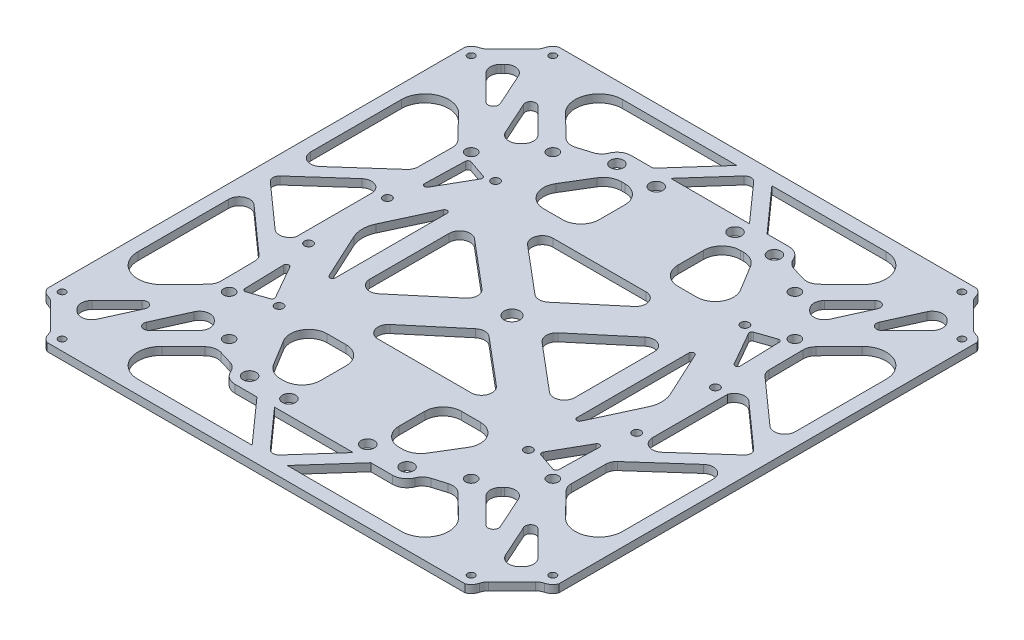
from build123d import *

# Parameters (mm, degrees)
SKETCH2_W               = 195
SKETCH2_H               = 195
BOSS_EXTRUDE1_DEPTH     = 3
CUT_EXTRUDE1_DEPTH      = 138.918454168
CUT_EXTRUDE1_DEPTH_BACK = 138.918454168
SKETCH3_R               = 1.6
CUT_EXTRUDE2_DEPTH      = 138.918454168
CUT_EXTRUDE2_DEPTH_BACK = 138.918454168
SKETCH4_R               = 2.11
SKETCH4_R_2             = 1.35
CUT_EXTRUDE3_DEPTH      = 138.918454168
CUT_EXTRUDE3_DEPTH_BACK = 138.918454168
SKETCH5_R               = 2.5
CUT_EXTRUDE4_DEPTH      = 138.918454168
CUT_EXTRUDE4_DEPTH_BACK = 138.918454168
SKETCH6_R               = 1.6
CUT_EXTRUDE5_DEPTH      = 138.918454168
CUT_EXTRUDE5_DEPTH_BACK = 138.918454168
CUT_EXTRUDE7_DEPTH      = 138.918454168
CUT_EXTRUDE7_DEPTH_BACK = 138.918454168
SKETCH8_R               = 3
SKETCH9_W               = 5.16198808
SKETCH9_H               = 152.468237428
BOSS_EXTRUDE2_DEPTH     = 3
FILLET1_R               = 9
BOSS_EXTRUDE3_DEPTH     = 3
FILLET2_DEPTH           = 3
FILLET3_R               = 2.5


with BuildPart() as part:
    # Sketch2 → Boss-Extrude1 (new body)
    with BuildSketch(Plane(origin=(0, 0, 0), x_dir=(1, 0, 0), z_dir=(0, 1, 0))):
        Rectangle(SKETCH2_W, SKETCH2_H)
    extrude(amount=BOSS_EXTRUDE1_DEPTH)

    # Sketch3 → Cut-Extrude1 (cut, two sides: drawn at the far end of the back side and taken through both)
    with BuildSketch(Plane(origin=(0, 3, 0), x_dir=(1, 0, 0), z_dir=(0, 1, 0)).offset(-CUT_EXTRUDE1_DEPTH_BACK)):
        with Locations(Location((47.5, 41.25, 0), (0, 0, 270))):
            Circle(SKETCH3_R)
        with Locations(Location((47.5, -41.25, 0), (0, 0, 90))):
            Circle(SKETCH3_R)
        with Locations(Location((-47.5, -41.25, 0), (0, 0, 270))):
            Circle(SKETCH3_R)
        with Locations(Location((-47.5, 41.25, 0), (0, 0, 90))):
            Circle(SKETCH3_R)
    extrude(amount=CUT_EXTRUDE1_DEPTH + CUT_EXTRUDE1_DEPTH_BACK, mode=Mode.SUBTRACT)

    # Sketch4 → Cut-Extrude2 (cut, two sides: drawn at the far end of the back side and taken through both)
    with BuildSketch(Plane(origin=(0, 3, 0), x_dir=(1, 0, 0), z_dir=(0, 1, 0)).offset(-CUT_EXTRUDE2_DEPTH_BACK)):
        with Locations(Location((46.123845661, 61.680194847, 0), (0, 0, 90))):
            Circle(SKETCH4_R)
        with Locations(Location((-61.680194847, 46.123845661, 0), (0, 0, 90))):
            Circle(SKETCH4_R)
        with Locations(Location((-77.943650814, 93.5, 0), (0, 0, 270))):
            Circle(SKETCH4_R_2)
        with Locations(Location((-93.5, 77.943650814, 0), (0, 0, 90))):
            Circle(SKETCH4_R_2)
        with Locations(Location((-46.123845661, 61.680194847, 0), (0, 0, 270))):
            Circle(SKETCH4_R)
        with Locations(Location((93.5, 77.943650814, 0), (0, 0, 270))):
            Circle(SKETCH4_R_2)
        with Locations(Location((77.943650814, 93.5, 0), (0, 0, 90))):
            Circle(SKETCH4_R_2)
        with Locations(Location((61.680194847, 46.123845661, 0), (0, 0, 270))):
            Circle(SKETCH4_R)
        with Locations(Location((61.680194847, -46.123845661, 0), (0, 0, 90))):
            Circle(SKETCH4_R)
        with Locations(Location((77.943650814, -93.5, 0), (0, 0, 270))):
            Circle(SKETCH4_R_2)
        with Locations(Location((93.5, -77.943650814, 0), (0, 0, 90))):
            Circle(SKETCH4_R_2)
        with Locations(Location((-46.123845661, -61.680194847, 0), (0, 0, 90))):
            Circle(SKETCH4_R)
        with Locations(Location((-93.5, -77.943650814, 0), (0, 0, 270))):
            Circle(SKETCH4_R_2)
        with Locations(Location((-77.943650814, -93.5, 0), (0, 0, 90))):
            Circle(SKETCH4_R_2)
        with Locations(Location((-61.680194847, -46.123845661, 0), (0, 0, 270))):
            Circle(SKETCH4_R)
        with Locations(Location((46.123845661, -61.680194847, 0), (0, 0, 270))):
            Circle(SKETCH4_R)
    extrude(amount=CUT_EXTRUDE2_DEPTH + CUT_EXTRUDE2_DEPTH_BACK, mode=Mode.SUBTRACT)

    # Sketch5 → Cut-Extrude3 (cut, two sides: drawn at the far end of the back side and taken through both)
    with BuildSketch(Plane(origin=(0, 3, 0), x_dir=(1, 0, 0), z_dir=(0, 1, 0)).offset(-CUT_EXTRUDE3_DEPTH_BACK)):
        with Locations(Location((30, 70, 0), (0, 0, 270))):
            Circle(SKETCH5_R)
        with Locations(Location((15, 70, 0), (0, 0, 270))):
            Circle(SKETCH5_R)
        with Locations(Location((-15, 70, 0), (0, 0, 90))):
            Circle(SKETCH5_R)
        with Locations(Location((-30, 70, 0), (0, 0, 90))):
            Circle(SKETCH5_R)
        with Locations(Location((-30, -70, 0), (0, 0, 270))):
            Circle(SKETCH5_R)
        with Locations(Location((-15, -70, 0), (0, 0, 270))):
            Circle(SKETCH5_R)
        with Locations(Location((15, -70, 0), (0, 0, 90))):
            Circle(SKETCH5_R)
        with Locations(Location((30, -70, 0), (0, 0, 90))):
            Circle(SKETCH5_R)
    extrude(amount=CUT_EXTRUDE3_DEPTH + CUT_EXTRUDE3_DEPTH_BACK, mode=Mode.SUBTRACT)

    # Sketch6 → Cut-Extrude4 (cut, two sides: drawn at the far end of the back side and taken through both)
    with BuildSketch(Plane(origin=(0, 3, 0), x_dir=(1, 0, 0), z_dir=(0, 1, 0)).offset(-CUT_EXTRUDE4_DEPTH_BACK)):
        with Locations(Location((-62.5, 15, 0), (0, 0, 270))):
            Circle(SKETCH6_R)
        with Locations(Location((-62.5, -15, 0), (0, 0, 90))):
            Circle(SKETCH6_R)
        with Locations(Location((62.5, -15, 0), (0, 0, 270))):
            Circle(SKETCH6_R)
        with Locations(Location((62.5, 15, 0), (0, 0, 90))):
            Circle(SKETCH6_R)
    extrude(amount=CUT_EXTRUDE4_DEPTH + CUT_EXTRUDE4_DEPTH_BACK, mode=Mode.SUBTRACT)

    # Sketch7 → Cut-Extrude5 (cut, two sides: drawn at the far end of the back side and taken through both)
    with BuildSketch(Plane(origin=(0, 3, 0), x_dir=(1, 0, 0), z_dir=(0, 1, 0)).offset(-CUT_EXTRUDE5_DEPTH_BACK)):
        with BuildLine():
            Line((-67.1, -15), (-67.099088544, 15.091567253))
            Line((-67.099088544, 15.091567253), (-66.810690491, 44.064798997))
            ThreePointArc((-66.810690491, 44.064798997), (-67.168435752, 45.972460378), (-68.225667159, 47.60016286))
            Line((-68.225667159, 47.60016286), (-92.33801192, 72.39859956))
            ThreePointArc((-92.33801192, 72.39859956), (-93.391805503, 73.22509409), (-94.627179243, 73.742226418))
            ThreePointArc((-94.627179243, 73.742226418), (-96.350328674, 74.657600533), (-97.5, 76.234118714))
            Line((-97.5, 76.234118714), (-97.5, -76.234118714))
            ThreePointArc((-97.5, -76.234118714), (-96.350328674, -74.657600533), (-94.627179243, -73.742226418))
            ThreePointArc((-94.627179243, -73.742226418), (-93.391805503, -73.22509409), (-92.33801192, -72.39859956))
            Line((-92.33801192, -72.39859956), (-68.225667159, -47.60016286))
            ThreePointArc((-68.225667159, -47.60016286), (-67.168435752, -45.972460378), (-66.810690491, -44.064798997))
            Line((-66.810690491, -44.064798997), (-67.099088544, -15.091567253))
            ThreePointArc((-67.099088544, -15.091567253), (-67.09977213, -15.045785894), (-67.1, -15))
        make_face()
        with BuildLine():
            ThreePointArc((-97.5, 79.653182914), (-96.342305944, 81.236642906), (-94.606672429, 82.150523302))
            ThreePointArc((-94.606672429, 82.150523302), (-93.388598506, 82.650187636), (-92.343175799, 83.450475015))
            Line((-92.343175799, 83.450475015), (-83.450475015, 92.343175799))
            ThreePointArc((-83.450475015, 92.343175799), (-82.650187636, 93.388598506), (-82.150523302, 94.606672429))
            ThreePointArc((-82.150523302, 94.606672429), (-81.236642906, 96.342305944), (-79.653182914, 97.5))
            Line((-79.653182914, 97.5), (-97.5, 97.5))
            Line((-97.5, 97.5), (-97.5, 79.653182914))
        make_face()
        with BuildLine():
            ThreePointArc((-94.606672429, -82.150523302), (-96.342305944, -81.236642906), (-97.5, -79.653182914))
            Line((-97.5, -79.653182914), (-97.5, -97.5))
            Line((-97.5, -97.5), (-79.653182914, -97.5))
            ThreePointArc((-79.653182914, -97.5), (-81.236642906, -96.342305944), (-82.150523302, -94.606672429))
            ThreePointArc((-82.150523302, -94.606672429), (-82.650187636, -93.388598506), (-83.450475015, -92.343175799))
            Line((-83.450475015, -92.343175799), (-92.343175799, -83.450475015))
            ThreePointArc((-92.343175799, -83.450475015), (-93.388598506, -82.650187636), (-94.606672429, -82.150523302))
        make_face()
        with BuildLine():
            Line((76.234118714, 97.5), (-76.234118714, 97.5))
            ThreePointArc((-76.234118714, 97.5), (-74.657600533, 96.350328674), (-73.742226418, 94.627179243))
            ThreePointArc((-73.742226418, 94.627179243), (-73.22509409, 93.391805503), (-72.39859956, 92.33801192))
            Line((-72.39859956, 92.33801192), (-48.235759925, 68.843679325))
            ThreePointArc((-48.235759925, 68.843679325), (-45.933721874, 67.570555303), (-43.304064218, 67.642141429))
            Line((-43.304064218, 67.642141429), (-38.28462916, 69.158674052))
            ThreePointArc((-38.28462916, 69.158674052), (-36.361057884, 70.251030176), (-35.097048147, 72.066422073))
            ThreePointArc((-35.097048147, 72.066422073), (-33.072838964, 74.561541483), (-30, 75.5))
            Line((-30, 75.5), (30, 75.5))
            ThreePointArc((30, 75.5), (33.072838964, 74.561541483), (35.097048147, 72.066422073))
            ThreePointArc((35.097048147, 72.066422073), (36.361057884, 70.251030176), (38.28462916, 69.158674052))
            Line((38.28462916, 69.158674052), (43.304064218, 67.642141429))
            ThreePointArc((43.304064218, 67.642141429), (45.933721874, 67.570555303), (48.235759925, 68.843679325))
            Line((48.235759925, 68.843679325), (72.39859956, 92.33801192))
            ThreePointArc((72.39859956, 92.33801192), (73.22509409, 93.391805503), (73.742226418, 94.627179243))
            ThreePointArc((73.742226418, 94.627179243), (74.657600533, 96.350328674), (76.234118714, 97.5))
        make_face()
        with BuildLine():
            ThreePointArc((-73.742226418, -94.627179243), (-74.657600533, -96.350328674), (-76.234118714, -97.5))
            Line((-76.234118714, -97.5), (76.234118714, -97.5))
            ThreePointArc((76.234118714, -97.5), (74.657600533, -96.350328674), (73.742226418, -94.627179243))
            ThreePointArc((73.742226418, -94.627179243), (73.22509409, -93.391805503), (72.39859956, -92.33801192))
            Line((72.39859956, -92.33801192), (48.235759925, -68.843679325))
            ThreePointArc((48.235759925, -68.843679325), (45.933721874, -67.570555303), (43.304064218, -67.642141429))
            Line((43.304064218, -67.642141429), (38.28462916, -69.158674052))
            ThreePointArc((38.28462916, -69.158674052), (36.361057884, -70.251030176), (35.097048147, -72.066422073))
            ThreePointArc((35.097048147, -72.066422073), (33.072838964, -74.561541483), (30, -75.5))
            Line((30, -75.5), (-30, -75.5))
            ThreePointArc((-30, -75.5), (-33.072838964, -74.561541483), (-35.097048147, -72.066422073))
            ThreePointArc((-35.097048147, -72.066422073), (-36.361057884, -70.251030176), (-38.28462916, -69.158674052))
            Line((-38.28462916, -69.158674052), (-43.304064218, -67.642141429))
            ThreePointArc((-43.304064218, -67.642141429), (-45.933721874, -67.570555303), (-48.235759925, -68.843679325))
            Line((-48.235759925, -68.843679325), (-72.39859956, -92.33801192))
            ThreePointArc((-72.39859956, -92.33801192), (-73.22509409, -93.391805503), (-73.742226418, -94.627179243))
        make_face()
        with BuildLine():
            Line((97.5, 97.5), (79.653182914, 97.5))
            ThreePointArc((79.653182914, 97.5), (81.236642906, 96.342305944), (82.150523302, 94.606672429))
            ThreePointArc((82.150523302, 94.606672429), (82.650187636, 93.388598506), (83.450475015, 92.343175799))
            Line((83.450475015, 92.343175799), (92.343175799, 83.450475015))
            ThreePointArc((92.343175799, 83.450475015), (93.388598506, 82.650187636), (94.606672429, 82.150523302))
            ThreePointArc((94.606672429, 82.150523302), (96.342305944, 81.236642906), (97.5, 79.653182914))
            Line((97.5, 79.653182914), (97.5, 97.5))
        make_face()
        with BuildLine():
            ThreePointArc((82.150523302, -94.606672429), (81.236642906, -96.342305944), (79.653182914, -97.5))
            Line((79.653182914, -97.5), (97.5, -97.5))
            Line((97.5, -97.5), (97.5, -79.653182914))
            ThreePointArc((97.5, -79.653182914), (96.342305944, -81.236642906), (94.606672429, -82.150523302))
            ThreePointArc((94.606672429, -82.150523302), (93.388598506, -82.650187636), (92.343175799, -83.450475015))
            Line((92.343175799, -83.450475015), (83.450475015, -92.343175799))
            ThreePointArc((83.450475015, -92.343175799), (82.650187636, -93.388598506), (82.150523302, -94.606672429))
        make_face()
        with BuildLine():
            ThreePointArc((94.627179243, -73.742226418), (96.350328674, -74.657600533), (97.5, -76.234118714))
            Line((97.5, -76.234118714), (97.5, 76.234118714))
            ThreePointArc((97.5, 76.234118714), (96.350328674, 74.657600533), (94.627179243, 73.742226418))
            ThreePointArc((94.627179243, 73.742226418), (93.391805503, 73.22509409), (92.33801192, 72.39859956))
            Line((92.33801192, 72.39859956), (68.225667159, 47.60016286))
            ThreePointArc((68.225667159, 47.60016286), (67.168435752, 45.972460378), (66.810690491, 44.064798997))
            Line((66.810690491, 44.064798997), (67.099088544, 15.091567253))
            ThreePointArc((67.099088544, 15.091567253), (67.09977213, 15.045785894), (67.1, 15))
            Line((67.1, 15), (67.099088544, -15.091567253))
            Line((67.099088544, -15.091567253), (66.810690491, -44.064798997))
            ThreePointArc((66.810690491, -44.064798997), (67.168435752, -45.972460378), (68.225667159, -47.60016286))
            Line((68.225667159, -47.60016286), (92.33801192, -72.39859956))
            ThreePointArc((92.33801192, -72.39859956), (93.391805503, -73.22509409), (94.627179243, -73.742226418))
        make_face()
    extrude(amount=CUT_EXTRUDE5_DEPTH + CUT_EXTRUDE5_DEPTH_BACK, mode=Mode.SUBTRACT)

    # Sketch8 → Cut-Extrude7 (cut, two sides: drawn at the far end of the back side and taken through both)
    with BuildSketch(Plane(origin=(0, 3, 0), x_dir=(1, 0, 0), z_dir=(0, 1, 0)).offset(-CUT_EXTRUDE7_DEPTH_BACK)):
        with Locations(Location((0, 0, 0), (0, 0, 270))):
            Circle(SKETCH8_R)
        with BuildLine():
            Line((-46.075946512, -21.34896745), (-46.075946512, 21.363521254))
            ThreePointArc((-46.075946512, 21.363521254), (-46.860319172, 22.339996984), (-47.982956213, 21.784630983))
            Line((-47.982956213, 21.784630983), (-56.124255266, 4.249445458))
            ThreePointArc((-56.124255266, 4.249445458), (-57.054155987, 0.045094312), (-56.129928738, -4.160507655))
            Line((-56.129928738, -4.160507655), (-47.98352356, -21.768853033))
            ThreePointArc((-47.98352356, -21.768853033), (-46.860977965, -22.325588422), (-46.075946512, -21.34896745))
        make_face()
        with BuildLine():
            Line((56.124255266, 4.249445458), (47.982956213, 21.784630983))
            ThreePointArc((47.982956213, 21.784630983), (46.860319172, 22.339996984), (46.075946512, 21.363521254))
            Line((46.075946512, 21.363521254), (46.075946512, -21.34896745))
            ThreePointArc((46.075946512, -21.34896745), (46.860977965, -22.325588422), (47.98352356, -21.768853033))
            Line((47.98352356, -21.768853033), (56.129928738, -4.160507655))
            ThreePointArc((56.129928738, -4.160507655), (57.054155987, 0.045094312), (56.124255266, 4.249445458))
        make_face()
        with BuildLine():
            Line((-58.318731361, 26.348348992), (-51.034926184, 39.095008052))
            ThreePointArc((-51.034926184, 39.095008052), (-50.967376772, 39.943698114), (-51.578125125, 40.536845815))
            Line((-51.578125125, 40.536845815), (-58.463843567, 42.903521965))
            ThreePointArc((-58.463843567, 42.903521965), (-59.359048857, 42.779356057), (-59.788541049, 41.984154106))
            Line((-59.788541049, 41.984154106), (-60.186627783, 26.870818896))
            ThreePointArc((-60.186627783, 26.870818896), (-59.456345727, 25.881451512), (-58.318731361, 26.348348992))
        make_face()
        with BuildLine():
            Line((-59.788541049, -41.984154106), (-60.186627783, -26.870818896))
            ThreePointArc((-60.186627783, -26.870818896), (-59.456345727, -25.881451512), (-58.318731361, -26.348348992))
            Line((-58.318731361, -26.348348992), (-51.034926184, -39.095008052))
            ThreePointArc((-51.034926184, -39.095008052), (-50.967376772, -39.943698114), (-51.578125125, -40.536845815))
            Line((-51.578125125, -40.536845815), (-58.463843567, -42.903521965))
            ThreePointArc((-58.463843567, -42.903521965), (-59.359048857, -42.779356057), (-59.788541049, -41.984154106))
        make_face()
        with BuildLine():
            Line((59.788541049, 41.984154106), (60.186627783, 26.870818896))
            ThreePointArc((60.186627783, 26.870818896), (59.456345727, 25.881451512), (58.318731361, 26.348348992))
            Line((58.318731361, 26.348348992), (51.034926184, 39.095008052))
            ThreePointArc((51.034926184, 39.095008052), (50.967376772, 39.943698114), (51.578125125, 40.536845815))
            Line((51.578125125, 40.536845815), (58.463843567, 42.903521965))
            ThreePointArc((58.463843567, 42.903521965), (59.359048857, 42.779356057), (59.788541049, 41.984154106))
        make_face()
        with BuildLine():
            Line((58.318731361, -26.348348992), (51.034926184, -39.095008052))
            ThreePointArc((51.034926184, -39.095008052), (50.967376772, -39.943698114), (51.578125125, -40.536845815))
            Line((51.578125125, -40.536845815), (58.463843567, -42.903521965))
            ThreePointArc((58.463843567, -42.903521965), (59.359048857, -42.779356057), (59.788541049, -41.984154106))
            Line((59.788541049, -41.984154106), (60.186627783, -26.870818896))
            ThreePointArc((60.186627783, -26.870818896), (59.456345727, -25.881451512), (58.318731361, -26.348348992))
        make_face()
        with BuildLine():
            Line((-29.190874416, -41.25), (-22, -41.25))
            ThreePointArc((-22, -41.25), (-17.050252532, -43.300252532), (-15, -48.25))
            Line((-15, -48.25), (-15, -58))
            ThreePointArc((-15, -58), (-17.050252532, -62.949747468), (-22, -65))
            Line((-22, -65), (-23.256091807, -65))
            ThreePointArc((-23.256091807, -65), (-26.685566957, -64.102352022), (-29.235481697, -61.639628628))
            Line((-29.235481697, -61.639628628), (-35.170264305, -51.889628628))
            ThreePointArc((-35.170264305, -51.889628628), (-35.293226438, -44.82052485), (-29.190874416, -41.25))
        make_face()
        with BuildLine():
            Line((29.190874416, 41.25), (22, 41.25))
            ThreePointArc((22, 41.25), (17.050252532, 43.300252532), (15, 48.25))
            Line((15, 48.25), (15, 58))
            ThreePointArc((15, 58), (17.050252532, 62.949747468), (22, 65))
            Line((22, 65), (23.256091807, 65))
            ThreePointArc((23.256091807, 65), (26.685566957, 64.102352022), (29.235481697, 61.639628628))
            Line((29.235481697, 61.639628628), (35.170264305, 51.889628628))
            ThreePointArc((35.170264305, 51.889628628), (35.293226438, 44.82052485), (29.190874416, 41.25))
        make_face()
        with BuildLine():
            Line((29.235481697, -61.639628628), (35.170264305, -51.889628628))
            ThreePointArc((35.170264305, -51.889628628), (35.293226438, -44.82052485), (29.190874416, -41.25))
            Line((29.190874416, -41.25), (22, -41.25))
            ThreePointArc((22, -41.25), (17.050252532, -43.300252532), (15, -48.25))
            Line((15, -48.25), (15, -58))
            ThreePointArc((15, -58), (17.050252532, -62.949747468), (22, -65))
            Line((22, -65), (23.256091807, -65))
            ThreePointArc((23.256091807, -65), (26.685566957, -64.102352022), (29.235481697, -61.639628628))
        make_face()
        with BuildLine():
            Line((-29.235481697, 61.639628628), (-35.170264305, 51.889628628))
            ThreePointArc((-35.170264305, 51.889628628), (-35.293226438, 44.82052485), (-29.190874416, 41.25))
            Line((-29.190874416, 41.25), (-22, 41.25))
            ThreePointArc((-22, 41.25), (-17.050252532, 43.300252532), (-15, 48.25))
            Line((-15, 48.25), (-15, 58))
            ThreePointArc((-15, 58), (-17.050252532, 62.949747468), (-22, 65))
            Line((-22, 65), (-23.256091807, 65))
            ThreePointArc((-23.256091807, 65), (-26.685566957, 64.102352022), (-29.235481697, 61.639628628))
        make_face()
        with BuildLine():
            Line((-55.317751874, 58.143142882), (-54.609127035, 58.851767722))
            ThreePointArc((-54.609127035, 58.851767722), (-53.437554159, 61.680194847), (-54.609127035, 64.508621971))
            Line((-54.609127035, 64.508621971), (-64.215657306, 74.115152242))
            ThreePointArc((-64.215657306, 74.115152242), (-66.766627573, 74.346473303), (-67.453044382, 71.878723174))
            Line((-67.453044382, 71.878723174), (-61.792526027, 59.327138995))
            ThreePointArc((-61.792526027, 59.327138995), (-58.865699631, 57.036815878), (-55.317751874, 58.143142882))
        make_face()
        with BuildLine():
            Line((-84.306093786, 81.480702778), (-85.014718626, 80.772077939))
            ThreePointArc((-85.014718626, 80.772077939), (-86.186291501, 77.943650814), (-85.014718626, 75.115223689))
            Line((-85.014718626, 75.115223689), (-75.408188355, 65.508693418))
            ThreePointArc((-75.408188355, 65.508693418), (-72.857218088, 65.277372358), (-72.170801279, 67.745122487))
            Line((-72.170801279, 67.745122487), (-77.831319634, 80.296706666))
            ThreePointArc((-77.831319634, 80.296706666), (-80.758146029, 82.587029783), (-84.306093786, 81.480702778))
        make_face()
        with BuildLine():
            Line((55.317751874, -58.143142882), (54.609127035, -58.851767722))
            ThreePointArc((54.609127035, -58.851767722), (53.437554159, -61.680194847), (54.609127035, -64.508621971))
            Line((54.609127035, -64.508621971), (64.215657306, -74.115152242))
            ThreePointArc((64.215657306, -74.115152242), (66.766627573, -74.346473303), (67.453044382, -71.878723174))
            Line((67.453044382, -71.878723174), (61.792526027, -59.327138995))
            ThreePointArc((61.792526027, -59.327138995), (58.865699631, -57.036815878), (55.317751874, -58.143142882))
        make_face()
        with BuildLine():
            Line((-32.5, -18.207707646), (-14.5051535, -3.060146984))
            ThreePointArc((-14.5051535, -3.060146984), (-13.081100012, 0), (-14.5051535, 3.060146984))
            Line((-14.5051535, 3.060146984), (-32.5, 18.207707646))
            ThreePointArc((-32.5, 18.207707646), (-36.763580055, 18.774114539), (-39.075946512, 15.147560662))
            Line((-39.075946512, 15.147560662), (-39.075946512, -15.147560662))
            ThreePointArc((-39.075946512, -15.147560662), (-36.763580055, -18.774114539), (-32.5, -18.207707646))
        make_face()
        with BuildLine():
            Line((67.453044382, 71.878723174), (61.792526027, 59.327138995))
            ThreePointArc((61.792526027, 59.327138995), (58.865699631, 57.036815878), (55.317751874, 58.143142882))
            Line((55.317751874, 58.143142882), (54.609127035, 58.851767722))
            ThreePointArc((54.609127035, 58.851767722), (53.437554159, 61.680194847), (54.609127035, 64.508621971))
            Line((54.609127035, 64.508621971), (64.215657306, 74.115152242))
            ThreePointArc((64.215657306, 74.115152242), (66.766627573, 74.346473303), (67.453044382, 71.878723174))
        make_face()
        with BuildLine():
            Line((77.831319634, 80.296706666), (72.170801279, 67.745122487))
            ThreePointArc((72.170801279, 67.745122487), (72.857218088, 65.277372358), (75.408188355, 65.508693418))
            Line((75.408188355, 65.508693418), (85.014718626, 75.115223689))
            ThreePointArc((85.014718626, 75.115223689), (86.186291501, 77.943650814), (85.014718626, 80.772077939))
            Line((85.014718626, 80.772077939), (84.306093786, 81.480702778))
            ThreePointArc((84.306093786, 81.480702778), (80.758146029, 82.587029783), (77.831319634, 80.296706666))
        make_face()
        with BuildLine():
            Line((84.306093786, -81.480702778), (85.014718626, -80.772077939))
            ThreePointArc((85.014718626, -80.772077939), (86.186291501, -77.943650814), (85.014718626, -75.115223689))
            Line((85.014718626, -75.115223689), (75.408188355, -65.508693418))
            ThreePointArc((75.408188355, -65.508693418), (72.857218088, -65.277372358), (72.170801279, -67.745122487))
            Line((72.170801279, -67.745122487), (77.831319634, -80.296706666))
            ThreePointArc((77.831319634, -80.296706666), (80.758146029, -82.587029783), (84.306093786, -81.480702778))
        make_face()
        with BuildLine():
            Line((-67.453044382, -71.878723174), (-61.792526027, -59.327138995))
            ThreePointArc((-61.792526027, -59.327138995), (-58.865699631, -57.036815878), (-55.317751874, -58.143142882))
            Line((-55.317751874, -58.143142882), (-54.609127035, -58.851767722))
            ThreePointArc((-54.609127035, -58.851767722), (-53.437554159, -61.680194847), (-54.609127035, -64.508621971))
            Line((-54.609127035, -64.508621971), (-64.215657306, -74.115152242))
            ThreePointArc((-64.215657306, -74.115152242), (-66.766627573, -74.346473303), (-67.453044382, -71.878723174))
        make_face()
        with BuildLine():
            Line((-77.831319634, -80.296706666), (-72.170801279, -67.745122487))
            ThreePointArc((-72.170801279, -67.745122487), (-72.857218088, -65.277372358), (-75.408188355, -65.508693418))
            Line((-75.408188355, -65.508693418), (-85.014718626, -75.115223689))
            ThreePointArc((-85.014718626, -75.115223689), (-86.186291501, -77.943650814), (-85.014718626, -80.772077939))
            Line((-85.014718626, -80.772077939), (-84.306093786, -81.480702778))
            ThreePointArc((-84.306093786, -81.480702778), (-80.758146029, -82.587029783), (-77.831319634, -80.296706666))
        make_face()
        with BuildLine():
            Line((-20.31441961, 26.25), (-2.575946512, 11.318247329))
            ThreePointArc((-2.575946512, 11.318247329), (0, 10.378394314), (2.575946512, 11.318247329))
            Line((2.575946512, 11.318247329), (20.31441961, 26.25))
            ThreePointArc((20.31441961, 26.25), (21.496171059, 30.681170701), (17.738473098, 33.310146984))
            Line((17.738473098, 33.310146984), (-17.738473098, 33.310146984))
            ThreePointArc((-17.738473098, 33.310146984), (-21.496171059, 30.681170701), (-20.31441961, 26.25))
        make_face()
        with BuildLine():
            Line((32.5, -18.207707646), (14.5051535, -3.060146984))
            ThreePointArc((14.5051535, -3.060146984), (13.081100012, 0), (14.5051535, 3.060146984))
            Line((14.5051535, 3.060146984), (32.5, 18.207707646))
            ThreePointArc((32.5, 18.207707646), (36.763580055, 18.774114539), (39.075946512, 15.147560662))
            Line((39.075946512, 15.147560662), (39.075946512, -15.147560662))
            ThreePointArc((39.075946512, -15.147560662), (36.763580055, -18.774114539), (32.5, -18.207707646))
        make_face()
        with BuildLine():
            Line((17.738473098, -33.310146984), (-17.738473098, -33.310146984))
            ThreePointArc((-17.738473098, -33.310146984), (-21.496171059, -30.681170701), (-20.31441961, -26.25))
            Line((-20.31441961, -26.25), (-2.575946512, -11.318247329))
            ThreePointArc((-2.575946512, -11.318247329), (0, -10.378394314), (2.575946512, -11.318247329))
            Line((2.575946512, -11.318247329), (20.31441961, -26.25))
            ThreePointArc((20.31441961, -26.25), (21.496171059, -30.681170701), (17.738473098, -33.310146984))
        make_face()
    extrude(amount=CUT_EXTRUDE7_DEPTH + CUT_EXTRUDE7_DEPTH_BACK, mode=Mode.SUBTRACT)

    # Sketch9 → Boss-Extrude2 (add)
    with BuildSketch(Plane(origin=(0, 0, 0), x_dir=(1, 0, 0), z_dir=(0, 1, 0))):
        Polygon((-76.234118714, 97.5), (76.234118714, 97.5), (75.78009356, 93.391805503), (72.39859956, 92.33801192), (-72.39859956, 92.33801192), (-74.953859457, 93.391805503), align=None)
        with Locations((-94.91900596, 0)):
            Rectangle(SKETCH9_W, SKETCH9_H)
        with Locations((94.91900596, 0)):
            Rectangle(SKETCH9_W, SKETCH9_H)
        Polygon((-74.953859457, -93.391805503), (-72.39859956, -92.33801192), (72.39859956, -92.33801192), (75.78009356, -93.391805503), (76.234118714, -97.5), (-76.234118714, -97.5), align=None)
    extrude(amount=BOSS_EXTRUDE2_DEPTH)

    # Fillet1
    fillet1_edges = [part.edges().sort_by_distance(p)[0] for p in [
        (92.33801192, 1.5, -72.39859956),
        (72.39859956, 1.5, -92.33801192),
        (-72.39859956, 1.5, -92.33801192),
        (-92.33801192, 1.5, -72.39859956),
        (-92.33801192, 1.5, 72.39859956),
        (-72.39859956, 1.5, 92.33801192),
        (72.39859956, 1.5, 92.33801192),
        (92.33801192, 1.5, 72.39859956),
    ]]
    fillet(fillet1_edges, radius=FILLET1_R)

    # Sketch10 → Boss-Extrude3 (add)
    with BuildSketch(Plane(origin=(0, 0, 0), x_dir=(1, 0, 0), z_dir=(0, 1, 0))):
        Polygon((0, 92.33801192), (-6.696265003, 92.33801192), (-21.696265003, 75.5), (-15, 75.5), align=None)
        Polygon((6.696265003, 92.33801192), (0, 92.33801192), (15, 75.5), (21.696265003, 75.5), align=None)
        Polygon((92.33801192, 0), (66.810630595, -22.74085098), (66.810649404, -29.437099228), (92.33801192, -6.696265003), align=None)
        Polygon((66.810502842, 22.740964787), (92.33801192, 0), (92.33801192, 6.696265003), (66.810484033, 29.437246546), align=None)
        Polygon((0, -92.33801192), (6.696265003, -92.33801192), (21.696265003, -75.5), (15, -75.5), align=None)
        Polygon((-6.696265003, -92.33801192), (0, -92.33801192), (-15, -75.5), (-21.696265003, -75.5), align=None)
        Polygon((-92.33801192, 0), (-92.33801192, -6.696265003), (-66.810649404, -29.437099228), (-66.810630595, -22.74085098), align=None)
        Polygon((-92.33801192, 6.696265003), (-92.33801192, 0), (-66.810502842, 22.740964787), (-66.810484033, 29.437246546), align=None)
    extrude(amount=BOSS_EXTRUDE3_DEPTH)

    # Fillet2: read off the stored shape, not the designer's step
    # Fillet2 outline → Fillet2 (add)
    with BuildSketch(Plane(origin=(0, 0, 0), x_dir=(1, 0, 0), z_dir=(0, 1, 0))):
        with BuildLine():
            Line((66.9575969, 29.306192298), (68.279071597, 28.12896778))
            ThreePointArc((68.279071597, 28.12896778), (67.298121129, 29.460927331), (66.939981385, 31.075893581))
            Line((66.939981385, 31.075893581), (66.9575969, 29.306192298))
        make_face()
        with BuildLine():
            ThreePointArc((92.33801192, 15.616643054), (89.974647713, 11.966790553), (85.67730028, 12.629903433))
            Line((85.67730028, 12.629903433), (92.33801192, 6.696265003))
            Line((92.33801192, 6.696265003), (92.33801192, 15.616643054))
        make_face()
        with BuildLine():
            ThreePointArc((67.099088544, 15.091567253), (69.873346764, 17.638265382), (73.533467197, 16.751869056))
            Line((73.533467197, 16.751869056), (67.024847514, 22.550017656))
            Line((67.024847514, 22.550017656), (67.099088544, 15.091567253))
        make_face()
        with BuildLine():
            Line((67.024847514, -22.550017656), (73.759846472, -16.550201))
            ThreePointArc((73.759846472, -16.550201), (69.462443763, -17.213289093), (67.099134833, -13.563340221))
            Line((67.099134833, -13.563340221), (67.099088544, -15.091567253))
            Line((67.099088544, -15.091567253), (67.024847514, -22.550017656))
        make_face()
        with BuildLine():
            Line((92.33801192, -6.696265003), (85.67730028, -12.629903433))
            ThreePointArc((85.67730028, -12.629903433), (89.974647713, -11.966790553), (92.33801192, -15.616643054))
            Line((92.33801192, -15.616643054), (92.33801192, -6.696265003))
        make_face()
        with BuildLine():
            ThreePointArc((66.939981385, -31.075893581), (67.298121129, -29.460927331), (68.279071597, -28.12896778))
            Line((68.279071597, -28.12896778), (66.9575969, -29.306192298))
            Line((66.9575969, -29.306192298), (66.939981385, -31.075893581))
        make_face()
        with BuildLine():
            ThreePointArc((-66.939981385, 31.075893581), (-67.298121129, 29.460927331), (-68.279071597, 28.12896778))
            Line((-68.279071597, 28.12896778), (-66.9575969, 29.306192298))
            Line((-66.9575969, 29.306192298), (-66.939981385, 31.075893581))
        make_face()
        with BuildLine():
            Line((-92.33801192, 6.696265003), (-85.67730028, 12.629903433))
            ThreePointArc((-85.67730028, 12.629903433), (-89.974647713, 11.966790553), (-92.33801192, 15.616643054))
            Line((-92.33801192, 15.616643054), (-92.33801192, 6.696265003))
        make_face()
        with BuildLine():
            ThreePointArc((-67.099088544, -15.091567253), (-69.873346764, -17.638265382), (-73.533467197, -16.751869056))
            Line((-73.533467197, -16.751869056), (-67.024847514, -22.550017656))
            Line((-67.024847514, -22.550017656), (-67.099088544, -15.091567253))
        make_face()
        with BuildLine():
            Line((-67.024847514, 22.550017656), (-73.759846472, 16.550201))
            ThreePointArc((-73.759846472, 16.550201), (-69.462443763, 17.213289093), (-67.099134833, 13.563340221))
            Line((-67.099134833, 13.563340221), (-67.099088544, 15.091567253))
            Line((-67.099088544, 15.091567253), (-67.024847514, 22.550017656))
        make_face()
        with BuildLine():
            Line((-66.9575969, -29.306192298), (-68.279071597, -28.12896778))
            ThreePointArc((-68.279071597, -28.12896778), (-67.298121129, -29.460927331), (-66.939981385, -31.075893581))
            Line((-66.939981385, -31.075893581), (-66.9575969, -29.306192298))
        make_face()
        with BuildLine():
            ThreePointArc((-92.33801192, -15.616643054), (-89.974647713, -11.966790553), (-85.67730028, -12.629903433))
            Line((-85.67730028, -12.629903433), (-92.33801192, -6.696265003))
            Line((-92.33801192, -6.696265003), (-92.33801192, -15.616643054))
        make_face()
    extrude(amount=FILLET2_DEPTH)

    # Fillet3
    fillet3_edges = [part.edges().sort_by_distance(p)[0] for p in [
        (-92.33801192, 1.5, 0),
        (0, 1.5, -92.33801192),
        (92.33801192, 1.5, 0),
        (0, 1.5, 92.33801192),
    ]]
    fillet(fillet3_edges, radius=FILLET3_R)


solid = part.part
